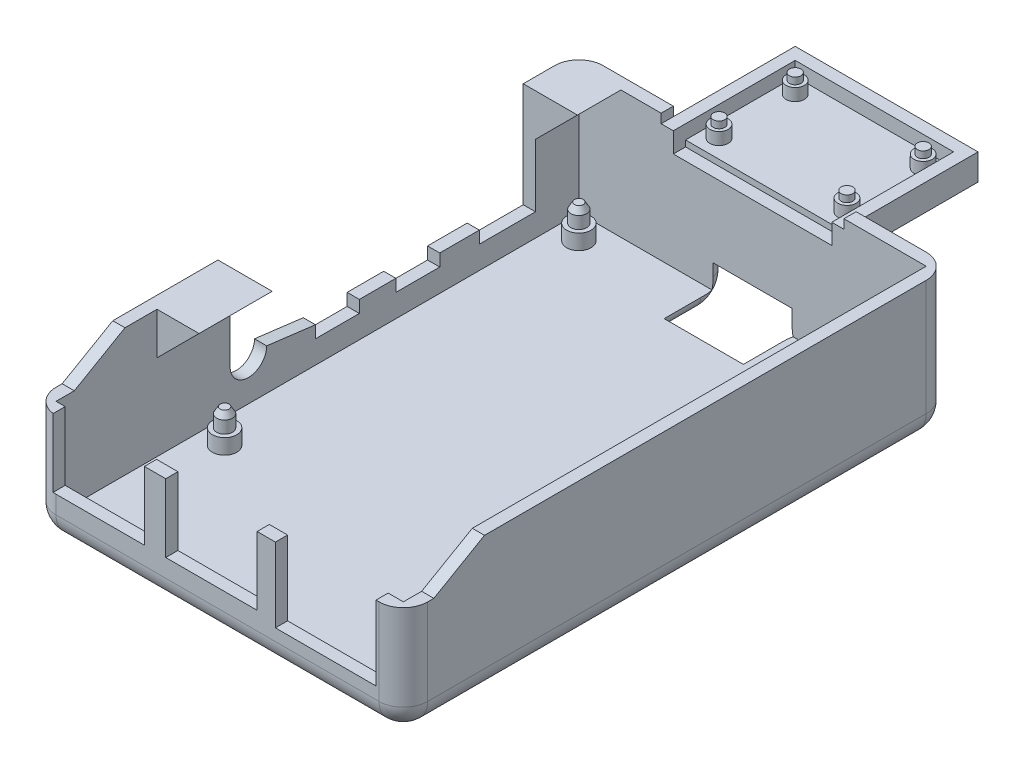
from build123d import *

# Parameters (mm, degrees)
SZKIC1_W                     = 61
SZKIC1_H                     = 89.8
DODANIE_WYCI_GNI_CIE1_DEPTH  = 2
SZKIC2_W                     = 61
SZKIC2_H                     = 89.8
SZKIC2_W_2                   = 57
SZKIC2_H_2                   = 85.8
DODANIE_WYCI_GNI_CIE2_DEPTH  = 16.15
SZKIC3_W                     = 15
SZKIC3_H                     = 11.2
SZKIC3_W_2                   = 16.5
SZKIC3_H_2                   = 12.2
WYTNIJ_WYCI_GNI_CIE1_DEPTH   = 2
SZKIC4_W                     = 13
SZKIC4_H                     = 5.95
WYTNIJ_WYCI_GNI_CIE2_DEPTH   = 10
SZKIC6_R                     = 3
WYTNIJ_WYCI_GNI_CIE4_DEPTH   = 2
SZKIC7_R                     = 2
DODANIE_WYCI_GNI_CIE3_DEPTH  = 2.5
SZKIC8_R                     = 1.3
DODANIE_WYCI_GNI_CIE4_DEPTH  = 2
SZKIC9_R                     = 1.3
DODANIE_WYCI_GNI_CIE5_DEPTH  = 1
DODANIE_WYCI_GNI_CIE5_TAPER  = 30
LUSTRO2_COPY_1_SKETCH_R      = 1.3
LUSTRO2_COPY_1_DEPTH         = 2
LUSTRO2_COPY_2_SKETCH_R      = 1.3
LUSTRO2_COPY_2_DEPTH         = 1
LUSTRO2_COPY_2_TAPER         = 30
SZKIC11_W                    = 2
SZKIC11_H                    = 30.57
DODANIE_WYCI_GNI_CIE6_DEPTH  = 4.8
WYTNIJ_WYCI_GNI_CIE5_DEPTH   = 2
DODANIE_WYCI_GNI_CIE7_DEPTH  = 12
DODANIE_WYCI_GNI_CIE8_DEPTH  = 7.13
WYTNIJ_WYCI_GNI_CIE6_REACH   = 81.144
SZKIC15_W                    = 3.13
SZKIC15_H                    = 4.9
SZKIC15_W_2                  = 10
DODANIE_WYCI_GNI_CIE9_DEPTH  = 3.13
DODANIE_WYCI_GNI_CIE10_DEPTH = 10
ZAOKR_GLENIE1_R              = 4
ZAOKR_GLENIE2_R              = 2
DODANIE_WYCI_GNI_CIE11_DEPTH = 4.8
DODANIE_WYCI_GNI_CIE12_DEPTH = 2
WYTNIJ_WYCI_GNI_CIE7_DEPTH   = 2
DODANIE_WYCI_GNI_CIE13_DEPTH = 20
SZKIC22_W                    = 26
SZKIC22_H                    = 2
DODANIE_WYCI_GNI_CIE14_DEPTH = 2.3
SZKIC23_R                    = 1.5
DODANIE_WYCI_GNI_CIE15_DEPTH = 2
SZKIC24_R                    = 0.95
DODANIE_WYCI_GNI_CIE16_DEPTH = 1.1
LUSTRO4_COPY_1_SKETCH_R      = 0.95
LUSTRO4_COPY_1_DEPTH         = 1.1


with BuildPart() as part:
    # Szkic1 → Dodanie-wyciągnięcie1 (new body)
    with BuildSketch(Plane(origin=(0, 0, 0), x_dir=(1, 0, 0), z_dir=(0, 1, 0))):
        Rectangle(SZKIC1_W, SZKIC1_H)
    extrude(amount=DODANIE_WYCI_GNI_CIE1_DEPTH)

    # Szkic2 → Dodanie-wyciągnięcie2 (add)
    with BuildSketch(Plane(origin=(0, 2, 0), x_dir=(1, 0, 0), z_dir=(0, 1, 0))):
        Rectangle(SZKIC2_W, SZKIC2_H)
        Rectangle(SZKIC2_W_2, SZKIC2_H_2, mode=Mode.SUBTRACT)
    extrude(amount=DODANIE_WYCI_GNI_CIE2_DEPTH)

    # Szkic3 → Wytnij-wyciągnięcie1 (cut)
    with BuildSketch(Plane.XY.offset(44.9)):
        with Locations((-19.5, 12.55)):
            Rectangle(SZKIC3_W, SZKIC3_H)
        with Locations((-1, 12.55)):
            Rectangle(SZKIC3_W, SZKIC3_H)
        with Locations((17.75, 12.05)):
            Rectangle(SZKIC3_W_2, SZKIC3_H_2)
    extrude(amount=-WYTNIJ_WYCI_GNI_CIE1_DEPTH, mode=Mode.SUBTRACT)

    # Szkic4 → Wytnij-wyciągnięcie2 (cut)
    with BuildSketch(Plane(origin=(0, 0, -44.9), x_dir=(-1, 0, 0), z_dir=(0, 0, -1))):
        with Locations((0, 2.975)):
            Rectangle(SZKIC4_W, SZKIC4_H)
    extrude(amount=-WYTNIJ_WYCI_GNI_CIE2_DEPTH, mode=Mode.SUBTRACT)

    # Szkic6 → Wytnij-wyciągnięcie4 (cut)
    with BuildSketch(Plane.ZY.offset(30.5)):
        with BuildLine():
            Line((14.33, 18.15), (-35.77, 18.15))
            Line((-35.77, 18.15), (-35.77, 5.75))
            Line((-35.77, 5.75), (-26.57, 5.75))
            Line((-26.57, 5.75), (-26.57, 7.75))
            Line((-26.57, 7.75), (-20.07, 7.75))
            Line((-20.07, 7.75), (-20.07, 5.75))
            Line((-20.07, 5.75), (-12.87, 5.75))
            Line((-12.87, 5.75), (-12.87, 7.75))
            Line((-12.87, 7.75), (-6.87, 7.75))
            Line((-6.87, 7.75), (-6.87, 5.75))
            Line((-6.87, 5.75), (0.33, 5.75))
            Line((0.33, 5.75), (0.33, 7.75))
            Line((0.33, 7.75), (8.33, 8.75))
            ThreePointArc((8.33, 8.75), (11.33, 11.75), (14.33, 8.75))
            Line((14.33, 8.75), (14.33, 18.15))
        make_face()
        with Locations((11.33, 8.75)):
            Circle(SZKIC6_R)
    extrude(amount=-WYTNIJ_WYCI_GNI_CIE4_DEPTH, mode=Mode.SUBTRACT)

    # Szkic7 → Dodanie-wyciągnięcie3 (add)
    with BuildSketch(Plane(origin=(0, 2, 0), x_dir=(1, 0, 0), z_dir=(0, 1, 0))):
        with Locations(Location((24.57, -19.17, 0), (0, 0, 270))):
            Circle(SZKIC7_R)
        with Locations(Location((-24.57, -19.17, 0), (0, 0, 270))):
            Circle(SZKIC7_R)
        with Locations(Location((24.57, 38.97, 0), (0, 0, 270))):
            Circle(SZKIC7_R)
        with Locations(Location((-24.57, 38.97, 0), (0, 0, 270))):
            Circle(SZKIC7_R)
    extrude(amount=DODANIE_WYCI_GNI_CIE3_DEPTH)

    # Szkic8 → Dodanie-wyciągnięcie4 (add)
    with BuildSketch(Plane(origin=(0, 4.5, 0), x_dir=(1, 0, 0), z_dir=(0, 1, 0))):
        with Locations(Location((-24.57, 38.97, 0), (0, 0, 270))):
            Circle(SZKIC8_R)
    dodanie_wyci_gni_cie4 = extrude(amount=DODANIE_WYCI_GNI_CIE4_DEPTH)

    # Szkic9 → Dodanie-wyciągnięcie5 (add)
    with BuildSketch(Plane(origin=(0, 6.5, 0), x_dir=(1, 0, 0), z_dir=(0, 1, 0))):
        with Locations(Location((-24.57, 38.97, 0), (0, 0, 270))):
            Circle(SZKIC9_R)
    dodanie_wyci_gni_cie5 = extrude(amount=DODANIE_WYCI_GNI_CIE5_DEPTH, taper=DODANIE_WYCI_GNI_CIE5_TAPER)

    # Lustro1: Dodanie-wyciągnięcie4, Dodanie-wyciągnięcie5 across plane
    add(dodanie_wyci_gni_cie4.mirror(Plane.ZY))
    add(dodanie_wyci_gni_cie5.mirror(Plane.ZY))

    # Lustro2: Dodanie-wyciągnięcie4, Dodanie-wyciągnięcie5 across plane
    add(dodanie_wyci_gni_cie4.mirror(Plane.XY.offset(-9.9)))
    add(dodanie_wyci_gni_cie5.mirror(Plane.XY.offset(-9.9)))

    # Lustro2 copy 1 sketch → Lustro2 copy 1 (add)
    with BuildSketch(Plane(origin=(0, 4.5, -19.8), x_dir=(-1, 0, 0), z_dir=(0, 1, 0))):
        with Locations(Location((-24.57, 38.97, 0), (0, 0, 270))):
            Circle(LUSTRO2_COPY_1_SKETCH_R)
    extrude(amount=LUSTRO2_COPY_1_DEPTH)

    # Lustro2 copy 2 sketch → Lustro2 copy 2 (add)
    with BuildSketch(Plane(origin=(0, 6.5, -19.8), x_dir=(-1, 0, 0), z_dir=(0, 1, 0))):
        with Locations(Location((-24.57, 38.97, 0), (0, 0, 270))):
            Circle(LUSTRO2_COPY_2_SKETCH_R)
    extrude(amount=LUSTRO2_COPY_2_DEPTH, taper=LUSTRO2_COPY_2_TAPER)

    # Szkic11 → Dodanie-wyciągnięcie6 (add)
    with BuildSketch(Plane(origin=(0, 18.15, 0), x_dir=(1, 0, 0), z_dir=(0, 1, 0))):
        Polygon((-28.5, 35.77), (-30.5, 35.77), (-30.5, 44.9), (-20.5, 44.9), (-20.5, 42.9), (-28.5, 42.9), align=None)
        with Locations((-29.5, -29.615)):
            Rectangle(SZKIC11_W, SZKIC11_H)
    extrude(amount=DODANIE_WYCI_GNI_CIE6_DEPTH)

    # Szkic12 → Wytnij-wyciągnięcie5 (cut)
    with BuildSketch(Plane.ZY.offset(30.5)):
        Polygon((44.9, 18.15), (39.9, 18.15), (31.586156124, 22.95), (44.9, 22.95), align=None)
    extrude(amount=-WYTNIJ_WYCI_GNI_CIE5_DEPTH, mode=Mode.SUBTRACT)

    # Szkic13 → Dodanie-wyciągnięcie7 (add)
    with BuildSketch(Plane(origin=(0, 0, 14.33), x_dir=(-1, 0, 0), z_dir=(0, 0, -1))):
        Polygon((28.5, 22.95), (21.6, 22.95), (28.5, 16.05), align=None)
    extrude(amount=-DODANIE_WYCI_GNI_CIE7_DEPTH)

    # Szkic14 → Dodanie-wyciągnięcie8 (add)
    with BuildSketch(Plane.XY.offset(-35.77)):
        Polygon((-21.6, 22.95), (-28.5, 22.95), (-28.5, 16.05), align=None)
    extrude(amount=-DODANIE_WYCI_GNI_CIE8_DEPTH)

    # Wytnij-wyciągnięcie6: up to this plane
    wytnij_wyci_gni_cie6_end = Plane(origin=(-21.6, 22.95, 26.33), z_dir=(0.7071067811865437, -0.7071067811865515, 0))
    # Szkic15 → Wytnij-wyciągnięcie6 (cut, up to the surface)
    with BuildSketch(Plane.ZY.offset(30.5), mode=Mode.PRIVATE) as wytnij_wyci_gni_cie6_sk1:
        with Locations((-38.335, 19.5)):
            Rectangle(SZKIC15_W, SZKIC15_H)
    wytnij_wyci_gni_cie6_tool1 = split(extrude(wytnij_wyci_gni_cie6_sk1.sketch, amount=-WYTNIJ_WYCI_GNI_CIE6_REACH, mode=Mode.PRIVATE), bisect_by=wytnij_wyci_gni_cie6_end, keep=Keep.BOTH, mode=Mode.PRIVATE)
    add(wytnij_wyci_gni_cie6_tool1.solids().sort_by_distance((-30.5, 19.5, -38.335))[0], mode=Mode.SUBTRACT)
    # Szkic15 → Wytnij-wyciągnięcie6 (cut, up to the surface)
    with BuildSketch(Plane.ZY.offset(30.5), mode=Mode.PRIVATE) as wytnij_wyci_gni_cie6_sk2:
        with Locations((20.33, 19.5)):
            Rectangle(SZKIC15_W_2, SZKIC15_H)
    wytnij_wyci_gni_cie6_tool2 = split(extrude(wytnij_wyci_gni_cie6_sk2.sketch, amount=-WYTNIJ_WYCI_GNI_CIE6_REACH, mode=Mode.PRIVATE), bisect_by=wytnij_wyci_gni_cie6_end, keep=Keep.BOTH, mode=Mode.PRIVATE)
    add(wytnij_wyci_gni_cie6_tool2.solids().sort_by_distance((-30.5, 19.5, 20.33))[0], mode=Mode.SUBTRACT)

    # Szkic16 → Dodanie-wyciągnięcie9 (add)
    with BuildSketch(Plane.XY.offset(-39.9)):
        Polygon((-27.5, 17.05), (-22.6, 21.95), (-24.014213562, 21.95), (-28.914213562, 17.05), align=None)
    extrude(amount=DODANIE_WYCI_GNI_CIE9_DEPTH)

    # Szkic17 → Dodanie-wyciągnięcie10 (add)
    with BuildSketch(Plane(origin=(0, 0, 25.33), x_dir=(-1, 0, 0), z_dir=(0, 0, -1))):
        Polygon((27.5, 17.05), (28.914213562, 17.05), (24.014213562, 21.95), (22.6, 21.95), align=None)
    extrude(amount=DODANIE_WYCI_GNI_CIE10_DEPTH)

    # Zaokrąglenie1
    zaokr_glenie1_edges = [part.edges().sort_by_distance(p)[0] for p in [
        (-18.5, 0, -44.9),
        (18.5, 0, -44.9),
        (30.5, 0, 0),
        (0, 0, 44.9),
        (-30.5, 0, 0),
        (-30.5, 9.075, 44.9),
        (30.5, 9.075, 44.9),
        (30.5, 9.075, -44.9),
        (-30.5, 11.475, -44.9),
    ]]
    fillet(zaokr_glenie1_edges, radius=ZAOKR_GLENIE1_R)

    # Zaokrąglenie2
    # the kernel refuses this fillet: 2 mm, written as the material it takes off along each edge
    with BuildSketch(Plane(origin=(-6.5, 4, -44.9), x_dir=(-1, 0, 0), z_dir=(0, 1, 0)), Plane(origin=(6.5, 5.95, -44.9), x_dir=(1, 0, 0), z_dir=(0, -1, 0))) as zaokr_glenie2_piece_1:
        with BuildLine():
            CenterArc((ZAOKR_GLENIE2_R, ZAOKR_GLENIE2_R), ZAOKR_GLENIE2_R, 180, 90)
            Line((0, ZAOKR_GLENIE2_R), (0, 0))
            Line((0, 0), (ZAOKR_GLENIE2_R, 0))
        make_face()
    extrude(amount=1.95, mode=Mode.SUBTRACT)
    with BuildSketch(Plane(origin=(-6.5, 4, -40.9), x_dir=(0, 0, -1), z_dir=(0, 1, 0))) as zaokr_glenie2_piece_2:
        with BuildLine():
            CenterArc((4 - ZAOKR_GLENIE2_R, ZAOKR_GLENIE2_R), ZAOKR_GLENIE2_R, 270, 90)
            Line((4 - ZAOKR_GLENIE2_R, 0), (4, 0))
            Line((4, 0), (4, ZAOKR_GLENIE2_R))
        make_face()
    revolve(axis=Axis((-6.5, 4, -40.9), (-1, 0, 0)), revolution_arc=90, mode=Mode.SUBTRACT)
    with BuildSketch(Plane(origin=(6.5, 4, -40.9), x_dir=(0, 0, -1), z_dir=(0, 1, 0))) as zaokr_glenie2_piece_3:
        with BuildLine():
            CenterArc((4 - ZAOKR_GLENIE2_R, -ZAOKR_GLENIE2_R), ZAOKR_GLENIE2_R, 0, 90)
            Line((4 - ZAOKR_GLENIE2_R, 0), (4, 0))
            Line((4, 0), (4, -ZAOKR_GLENIE2_R))
        make_face()
    revolve(axis=Axis((6.5, 4, -40.9), (-1, 0, 0)), revolution_arc=90, mode=Mode.SUBTRACT)
    with BuildSketch(Plane(origin=(-6.5, 5.95, -44.9), x_dir=(0, 1, 0), z_dir=(1, 0, 0)), Plane(origin=(6.5, 0, -34.9), x_dir=(0, 0, 1), z_dir=(-1, 0, 0))) as zaokr_glenie2_piece_4:
        with BuildLine():
            CenterArc((ZAOKR_GLENIE2_R, ZAOKR_GLENIE2_R), ZAOKR_GLENIE2_R, 180, 90)
            Line((0, ZAOKR_GLENIE2_R), (0, 0))
            Line((0, 0), (ZAOKR_GLENIE2_R, 0))
        make_face()
    extrude(amount=13, mode=Mode.SUBTRACT)
    with BuildSketch(Plane(origin=(-6.5, 0, -40.9), x_dir=(0, 1, 0), z_dir=(0, 0, 1))) as zaokr_glenie2_piece_5:
        with BuildLine():
            CenterArc((ZAOKR_GLENIE2_R, ZAOKR_GLENIE2_R), ZAOKR_GLENIE2_R, 180, 90)
            Line((0, ZAOKR_GLENIE2_R), (0, 0))
            Line((0, 0), (ZAOKR_GLENIE2_R, 0))
        make_face()
    extrude(amount=6, mode=Mode.SUBTRACT)
    with BuildSketch(Plane(origin=(6.5, 0, -40.9), x_dir=(0, 1, 0), z_dir=(0, 0, 1))) as zaokr_glenie2_piece_6:
        with BuildLine():
            CenterArc((ZAOKR_GLENIE2_R, -ZAOKR_GLENIE2_R), ZAOKR_GLENIE2_R, 90, 90)
            Line((0, -ZAOKR_GLENIE2_R), (0, 0))
            Line((0, 0), (ZAOKR_GLENIE2_R, 0))
        make_face()
    extrude(amount=6, mode=Mode.SUBTRACT)
    with BuildSketch(Plane(origin=(-6.5, 4, -44.9), x_dir=(-1, 0, 0), z_dir=(0, 1, 0))) as zaokr_glenie2_piece_7a_section:
        with BuildLine():
            CenterArc((ZAOKR_GLENIE2_R, ZAOKR_GLENIE2_R), ZAOKR_GLENIE2_R, 180, 90)
            Line((0, ZAOKR_GLENIE2_R), (0, 0))
            Line((0, 0), (ZAOKR_GLENIE2_R, 0))
        make_face()
    zaokr_glenie2_piece_7a = extrude(amount=6.95, mode=Mode.PRIVATE)
    zaokr_glenie2_piece_7a = split(zaokr_glenie2_piece_7a, bisect_by=Plane(origin=(-6.952790229, 5.95, -44.447209771), z_dir=(0, 1, 0)), keep=Keep.TOP, mode=Mode.PRIVATE)
    with BuildSketch(Plane(origin=(-11.5, 5.95, -44.9), x_dir=(0, 1, 0), z_dir=(1, 0, 0))) as zaokr_glenie2_piece_7b_section:
        with BuildLine():
            CenterArc((ZAOKR_GLENIE2_R, ZAOKR_GLENIE2_R), ZAOKR_GLENIE2_R, 180, 90)
            Line((0, ZAOKR_GLENIE2_R), (0, 0))
            Line((0, 0), (ZAOKR_GLENIE2_R, 0))
        make_face()
    zaokr_glenie2_piece_7b = extrude(amount=18, mode=Mode.PRIVATE)
    zaokr_glenie2_piece_7b = split(zaokr_glenie2_piece_7b, bisect_by=Plane(origin=(-6.5, 6.402790229, -44.447209771), z_dir=(-1, 0, 0)), keep=Keep.TOP, mode=Mode.PRIVATE)
    zaokr_glenie2_piece_7 = zaokr_glenie2_piece_7a & zaokr_glenie2_piece_7b
    add(zaokr_glenie2_piece_7, mode=Mode.SUBTRACT)
    with BuildSketch(Plane(origin=(-6.5, 5.95, -44.9), x_dir=(0, 1, 0), z_dir=(1, 0, 0))) as zaokr_glenie2_piece_8a_section:
        with BuildLine():
            CenterArc((ZAOKR_GLENIE2_R, ZAOKR_GLENIE2_R), ZAOKR_GLENIE2_R, 180, 90)
            Line((0, ZAOKR_GLENIE2_R), (0, 0))
            Line((0, 0), (ZAOKR_GLENIE2_R, 0))
        make_face()
    zaokr_glenie2_piece_8a = extrude(amount=18, mode=Mode.PRIVATE)
    zaokr_glenie2_piece_8a = split(zaokr_glenie2_piece_8a, bisect_by=Plane(origin=(6.5, 6.402790229, -44.447209771), z_dir=(1, 0, 0)), keep=Keep.TOP, mode=Mode.PRIVATE)
    with BuildSketch(Plane(origin=(6.5, 10.95, -44.9), x_dir=(1, 0, 0), z_dir=(0, -1, 0))) as zaokr_glenie2_piece_8b_section:
        with BuildLine():
            CenterArc((ZAOKR_GLENIE2_R, ZAOKR_GLENIE2_R), ZAOKR_GLENIE2_R, 180, 90)
            Line((0, ZAOKR_GLENIE2_R), (0, 0))
            Line((0, 0), (ZAOKR_GLENIE2_R, 0))
        make_face()
    zaokr_glenie2_piece_8b = extrude(amount=6.95, mode=Mode.PRIVATE)
    zaokr_glenie2_piece_8b = split(zaokr_glenie2_piece_8b, bisect_by=Plane(origin=(6.952790229, 5.95, -44.447209771), z_dir=(0, 1, 0)), keep=Keep.TOP, mode=Mode.PRIVATE)
    zaokr_glenie2_piece_8 = zaokr_glenie2_piece_8a & zaokr_glenie2_piece_8b
    add(zaokr_glenie2_piece_8, mode=Mode.SUBTRACT)
    with BuildSketch(Plane(origin=(-6.5, 0, -40.9), x_dir=(0, 1, 0), z_dir=(0, 0, 1))) as zaokr_glenie2_piece_9a_section:
        with BuildLine():
            CenterArc((ZAOKR_GLENIE2_R, ZAOKR_GLENIE2_R), ZAOKR_GLENIE2_R, 180, 90)
            Line((0, ZAOKR_GLENIE2_R), (0, 0))
            Line((0, 0), (ZAOKR_GLENIE2_R, 0))
        make_face()
    zaokr_glenie2_piece_9a = extrude(amount=11, mode=Mode.PRIVATE)
    zaokr_glenie2_piece_9a = split(zaokr_glenie2_piece_9a, bisect_by=Plane(origin=(-6.952790229, 0.452790229, -34.9), z_dir=(0, 0, 1)), keep=Keep.TOP, mode=Mode.PRIVATE)
    with BuildSketch(Plane(origin=(6.5, 0, -34.9), x_dir=(0, 0, 1), z_dir=(-1, 0, 0))) as zaokr_glenie2_piece_9b_section:
        with BuildLine():
            CenterArc((ZAOKR_GLENIE2_R, ZAOKR_GLENIE2_R), ZAOKR_GLENIE2_R, 180, 90)
            Line((0, ZAOKR_GLENIE2_R), (0, 0))
            Line((0, 0), (ZAOKR_GLENIE2_R, 0))
        make_face()
    zaokr_glenie2_piece_9b = extrude(amount=18, mode=Mode.PRIVATE)
    zaokr_glenie2_piece_9b = split(zaokr_glenie2_piece_9b, bisect_by=Plane(origin=(-6.5, 0.452790229, -34.447209771), z_dir=(-1, 0, 0)), keep=Keep.TOP, mode=Mode.PRIVATE)
    zaokr_glenie2_piece_9 = zaokr_glenie2_piece_9a & zaokr_glenie2_piece_9b
    add(zaokr_glenie2_piece_9, mode=Mode.SUBTRACT)
    with BuildSketch(Plane(origin=(6.5, 0, -40.9), x_dir=(0, 1, 0), z_dir=(0, 0, 1))) as zaokr_glenie2_piece_10a_section:
        with BuildLine():
            CenterArc((ZAOKR_GLENIE2_R, -ZAOKR_GLENIE2_R), ZAOKR_GLENIE2_R, 90, 90)
            Line((0, -ZAOKR_GLENIE2_R), (0, 0))
            Line((0, 0), (ZAOKR_GLENIE2_R, 0))
        make_face()
    zaokr_glenie2_piece_10a = extrude(amount=11, mode=Mode.PRIVATE)
    zaokr_glenie2_piece_10a = split(zaokr_glenie2_piece_10a, bisect_by=Plane(origin=(6.952790229, 0.452790229, -34.9), z_dir=(0, 0, 1)), keep=Keep.TOP, mode=Mode.PRIVATE)
    with BuildSketch(Plane(origin=(11.5, 0, -34.9), x_dir=(0, 0, 1), z_dir=(-1, 0, 0))) as zaokr_glenie2_piece_10b_section:
        with BuildLine():
            CenterArc((ZAOKR_GLENIE2_R, ZAOKR_GLENIE2_R), ZAOKR_GLENIE2_R, 180, 90)
            Line((0, ZAOKR_GLENIE2_R), (0, 0))
            Line((0, 0), (ZAOKR_GLENIE2_R, 0))
        make_face()
    zaokr_glenie2_piece_10b = extrude(amount=18, mode=Mode.PRIVATE)
    zaokr_glenie2_piece_10b = split(zaokr_glenie2_piece_10b, bisect_by=Plane(origin=(6.5, 0.452790229, -34.447209771), z_dir=(1, 0, 0)), keep=Keep.TOP, mode=Mode.PRIVATE)
    zaokr_glenie2_piece_10 = zaokr_glenie2_piece_10a & zaokr_glenie2_piece_10b
    add(zaokr_glenie2_piece_10, mode=Mode.SUBTRACT)

    # Szkic19 → Dodanie-wyciągnięcie11 (add)
    with BuildSketch(Plane(origin=(0, 18.15, 0), x_dir=(1, 0, 0), z_dir=(0, 1, 0))):
        with BuildLine():
            Line((28.5, -31.586156124), (30.5, -31.586156124))
            Line((30.5, -31.586156124), (30.5, 40.9))
            ThreePointArc((30.5, 40.9), (29.328427125, 43.728427125), (26.5, 44.9))
            Line((26.5, 44.9), (-20.5, 44.9))
            Line((-20.5, 44.9), (-20.5, 42.9))
            Line((-20.5, 42.9), (28.5, 42.9))
            Line((28.5, 42.9), (28.5, -31.586156124))
        make_face()
    extrude(amount=DODANIE_WYCI_GNI_CIE11_DEPTH)

    # Szkic20 → Dodanie-wyciągnięcie12 (add)
    with BuildSketch(Plane(origin=(30.5, 0, 0), x_dir=(0, 0, -1), z_dir=(1, 0, 0))):
        Polygon((-31.586156124, 22.95), (-39.9, 18.15), (-31.586156124, 18.15), align=None)
    extrude(amount=-DODANIE_WYCI_GNI_CIE12_DEPTH)

    # Szkic18 → Wytnij-wyciągnięcie7 (cut)
    with BuildSketch(Plane(origin=(0, 0, -44.9), x_dir=(-1, 0, 0), z_dir=(0, 0, -1))):
        Polygon((-15, 22.95), (-15, 21.45), (-13, 21.45), (-13, 18.15), (13, 18.15), (13, 21.45), (15, 21.45), (15, 22.95), align=None)
    extrude(amount=-WYTNIJ_WYCI_GNI_CIE7_DEPTH, mode=Mode.SUBTRACT)

    # Szkic21 → Dodanie-wyciągnięcie13 (add)
    with BuildSketch(Plane(origin=(0, 0, -44.9), x_dir=(-1, 0, 0), z_dir=(0, 0, -1))):
        Polygon((-15, 21.45), (-13, 21.45), (-13, 19.15), (13, 19.15), (13, 21.45), (15, 21.45), (15, 17.15), (-15, 17.15), align=None)
    extrude(amount=DODANIE_WYCI_GNI_CIE13_DEPTH)

    # Szkic22 → Dodanie-wyciągnięcie14 (add)
    with BuildSketch(Plane(origin=(0, 19.15, 0), x_dir=(1, 0, 0), z_dir=(0, 1, 0))):
        with Locations((0, 63.9)):
            Rectangle(SZKIC22_W, SZKIC22_H)
    extrude(amount=DODANIE_WYCI_GNI_CIE14_DEPTH)

    # Szkic23 → Dodanie-wyciągnięcie15 (add)
    with BuildSketch(Plane(origin=(0, 19.15, 0), x_dir=(1, 0, 0), z_dir=(0, 1, 0))):
        with Locations(Location((10.5, 47.9, 0), (0, 0, 90))):
            Circle(SZKIC23_R)
        with Locations(Location((-10.5, 47.9, 0), (0, 0, 90))):
            Circle(SZKIC23_R)
        with Locations(Location((-10.5, 60.4, 0), (0, 0, 90))):
            Circle(SZKIC23_R)
        with Locations(Location((10.5, 60.4, 0), (0, 0, 90))):
            Circle(SZKIC23_R)
    extrude(amount=DODANIE_WYCI_GNI_CIE15_DEPTH)

    # Szkic24 → Dodanie-wyciągnięcie16 (add)
    with BuildSketch(Plane(origin=(0, 21.15, 0), x_dir=(1, 0, 0), z_dir=(0, 1, 0))):
        with Locations(Location((-10.5, 60.4, 0), (0, 0, 270))):
            Circle(SZKIC24_R)
    dodanie_wyci_gni_cie16 = extrude(amount=DODANIE_WYCI_GNI_CIE16_DEPTH)

    # Lustro3: Dodanie-wyciągnięcie16 across plane
    add(dodanie_wyci_gni_cie16.mirror(Plane.ZY))

    # Lustro4: Dodanie-wyciągnięcie16 across plane
    add(dodanie_wyci_gni_cie16.mirror(Plane(origin=(0, 0, -54.15), x_dir=(1, 0, 0), z_dir=(0, 0, -1))))

    # Lustro4 copy 1 sketch → Lustro4 copy 1 (add)
    with BuildSketch(Plane(origin=(0, 21.15, -108.3), x_dir=(-1, 0, 0), z_dir=(0, 1, 0))):
        with Locations(Location((-10.5, 60.4, 0), (0, 0, 270))):
            Circle(LUSTRO4_COPY_1_SKETCH_R)
    extrude(amount=LUSTRO4_COPY_1_DEPTH)


solid = part.part
